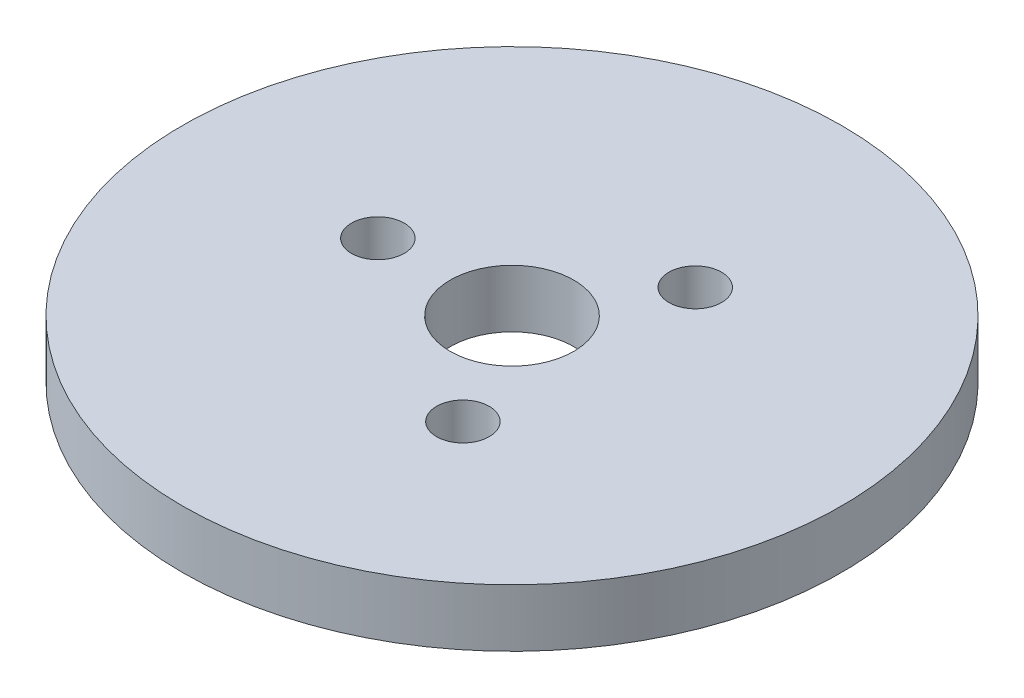
from build123d import *

# Parameters (mm, degrees)
SKETCH1_R           = 80
BOSS_EXTRUDE1_DEPTH = 14
SKETCH2_R           = 15
CUT_EXTRUDE1_DEPTH  = 115
SKETCH3_R           = 6.392646993
CUT_EXTRUDE2_DEPTH  = 13.72670083
CIRPATTERN1_COUNT   = 3


with BuildPart() as part:
    # Sketch1 → Boss-Extrude1 (new body)
    with BuildSketch(Plane(origin=(0, 0, 0), x_dir=(1, 0, 0), z_dir=(0, 1, 0))):
        Circle(SKETCH1_R)
    extrude(amount=BOSS_EXTRUDE1_DEPTH)

    # Sketch2 → Cut-Extrude1 (cut, through all)
    with BuildSketch(Plane(origin=(0, 0, 0), x_dir=(1, 0, 0), z_dir=(0, 1, 0))):
        Circle(SKETCH2_R)
    extrude(amount=CUT_EXTRUDE1_DEPTH, mode=Mode.SUBTRACT)

    # Sketch3 → Cut-Extrude2 (cut)
    with BuildSketch(Plane(origin=(0, 14, 0), x_dir=(1, 0, 0), z_dir=(0, 1, 0))):
        with Locations((-32.564694412, 0)):
            Circle(SKETCH3_R)
    cut_extrude2 = extrude(amount=-CUT_EXTRUDE2_DEPTH, mode=Mode.SUBTRACT)

    # CirPattern1: Cut-Extrude2 ×3 about axis
    cirpattern1_axis = Axis((0, 0, 0), (0, 1, 0))
    for i in range(1, CIRPATTERN1_COUNT):
        add(cut_extrude2.rotate(cirpattern1_axis, i * 360 / CIRPATTERN1_COUNT), mode=Mode.SUBTRACT)


solid = part.part
